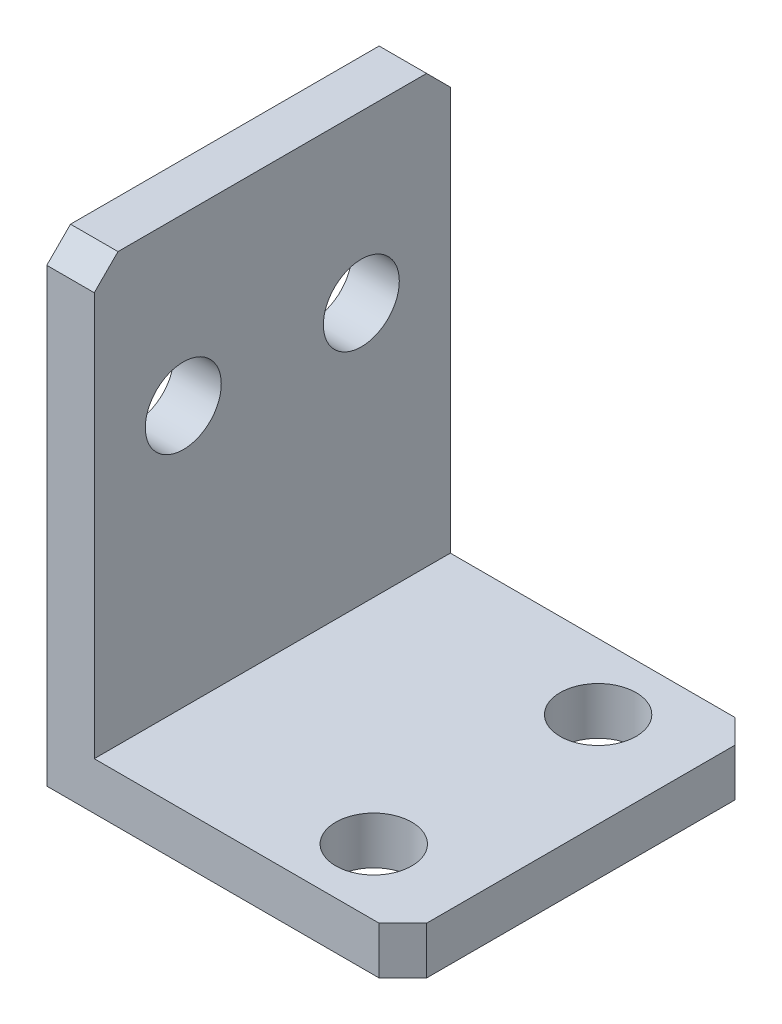
from build123d import *

# Parameters (mm, degrees)
BODY_DEPTH              = 15
CHAMFER1_SIZE           = 1
F_3_2_3_2_FORSENSOR_D   = 3.2
F_3_2_3_2_FORCARRIAGE_D = 3.2


with BuildPart() as part:
    # Sketch1 → Body (new body)
    with BuildSketch(Plane.XY):
        Polygon((0, 0), (0, 20), (2, 20), (2, 2), (15, 2), (15, 0), align=None)
    extrude(amount=BODY_DEPTH)

    # Chamfer1
    chamfer1_edges = [part.edges().sort_by_distance(p)[0] for p in [
        (15, 1, 0),
        (15, 1, 15),
        (1, 20, 0),
        (1, 20, 15),
    ]]
    chamfer(chamfer1_edges, length=CHAMFER1_SIZE)

    # Ø3.2 (3.2) ForSensor (through all)
    with Locations(Plane(origin=(0, 2, 0), x_dir=(1, 0, 0), z_dir=(0, 1, 0))):
        with Locations((11, -2.775), (11, -12.225)):
            Hole(F_3_2_3_2_FORSENSOR_D / 2)

    # Ø3.2 (3.2) ForCarriage (through all)
    with Locations(Plane(origin=(2, 0, 0), x_dir=(0, 0, -1), z_dir=(1, 0, 0))):
        with Locations((-11.25, 13), (-3.75, 13)):
            Hole(F_3_2_3_2_FORCARRIAGE_D / 2)


solid = part.part
